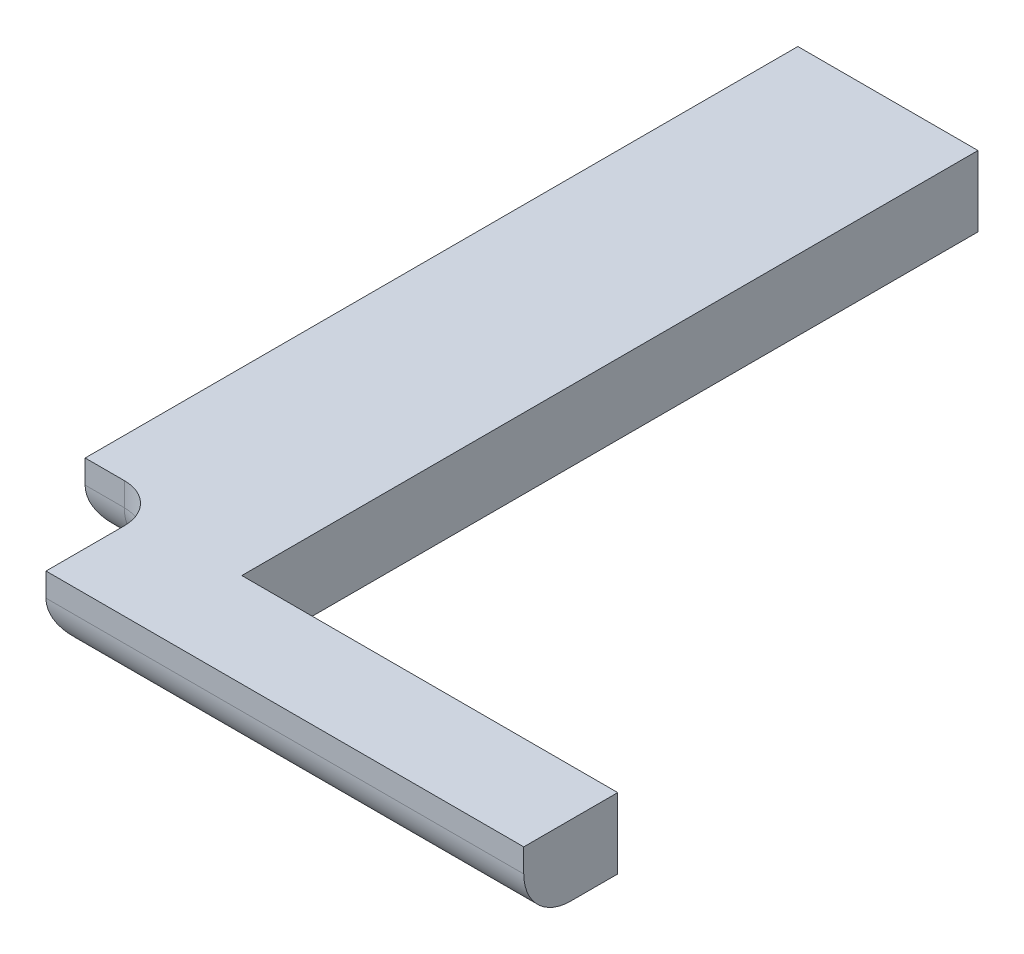
from build123d import *

# Parameters (mm, degrees)
EXTRUDE_1_DEPTH     = 9
FILLET_1_R          = 6
SKETCH_2_R          = 6
CUT_EXTRUDE_1_DEPTH = 3


with BuildPart() as part:
    # 草圖1 → 填料-伸長1 (new body)
    with BuildSketch(Plane(origin=(0, 0, 0), x_dir=(1, 0, 0), z_dir=(0, 1, 0))):
        with BuildLine():
            Line((0, 0), (-48, 0))
            Line((-48, 0), (-48, 94))
            Line((-48, 94), (-71, 94))
            Line((-71, 94), (-71, 3))
            Line((-71, 3), (-66, 3))
            ThreePointArc((-66, 3), (-62.464466094, 1.535533906), (-61, -2))
            Line((-61, -2), (-61, -12))
            Line((-61, -12), (0, -12))
            Line((0, -12), (0, 0))
        make_face()
    extrude(amount=EXTRUDE_1_DEPTH)

    # 圓角1
    # the kernel refuses this fillet: 6 mm, written as the material it takes off along each edge
    with BuildSketch(Plane(origin=(-76, 0, 12), x_dir=(0, 1, 0), z_dir=(1, 0, 0))) as fillet_1_piece_1:
        with BuildLine():
            CenterArc((FILLET_1_R, -FILLET_1_R), FILLET_1_R, 90, 90)
            Line((0, -FILLET_1_R), (0, 0))
            Line((0, 0), (FILLET_1_R, 0))
        make_face()
    extrude(amount=91, mode=Mode.SUBTRACT)
    with BuildSketch(Plane(origin=(-61, 0, 2), x_dir=(0, 1, 0), z_dir=(0, 0, 1))) as fillet_1_piece_2:
        with BuildLine():
            CenterArc((FILLET_1_R, -FILLET_1_R), FILLET_1_R, 90, 90)
            Line((0, -FILLET_1_R), (0, 0))
            Line((0, 0), (FILLET_1_R, 0))
        make_face()
    extrude(amount=25, mode=Mode.SUBTRACT)
    with BuildSketch(Plane(origin=(-66, 0, 2), x_dir=(0, 0, -1), z_dir=(-1, 0, 0))) as fillet_1_piece_3:
        with BuildLine():
            CenterArc((5 + FILLET_1_R, -FILLET_1_R), FILLET_1_R, 90, 90)
            Line((5 + FILLET_1_R, 0), (5, 0))
            Line((5, 0), (5, -FILLET_1_R))
        make_face()
    revolve(axis=Axis((-66, 0, 2), (0, -1, 0)), revolution_arc=90, mode=Mode.SUBTRACT)
    with BuildSketch(Plane(origin=(-71, 0, -109), x_dir=(0, 1, 0), z_dir=(0, 0, 1))) as fillet_1_piece_4:
        with BuildLine():
            CenterArc((FILLET_1_R, -FILLET_1_R), FILLET_1_R, 90, 90)
            Line((0, -FILLET_1_R), (0, 0))
            Line((0, 0), (FILLET_1_R, 0))
        make_face()
    extrude(amount=121, mode=Mode.SUBTRACT)
    with BuildSketch(Plane(origin=(-86, 0, -3), x_dir=(0, 1, 0), z_dir=(1, 0, 0))) as fillet_1_piece_5:
        with BuildLine():
            CenterArc((FILLET_1_R, -FILLET_1_R), FILLET_1_R, 90, 90)
            Line((0, -FILLET_1_R), (0, 0))
            Line((0, 0), (FILLET_1_R, 0))
        make_face()
    extrude(amount=20, mode=Mode.SUBTRACT)

    # 草圖2 → 除料-伸長1 (cut)
    with BuildSketch(Plane.XZ):
        with Locations(Location((-56, -84, 0), (0, 0, 270))):
            Circle(SKETCH_2_R)
        with Locations(Location((-56, -64, 0), (0, 0, 270))):
            Circle(SKETCH_2_R)
    extrude(amount=-CUT_EXTRUDE_1_DEPTH, mode=Mode.SUBTRACT)


solid = part.part
